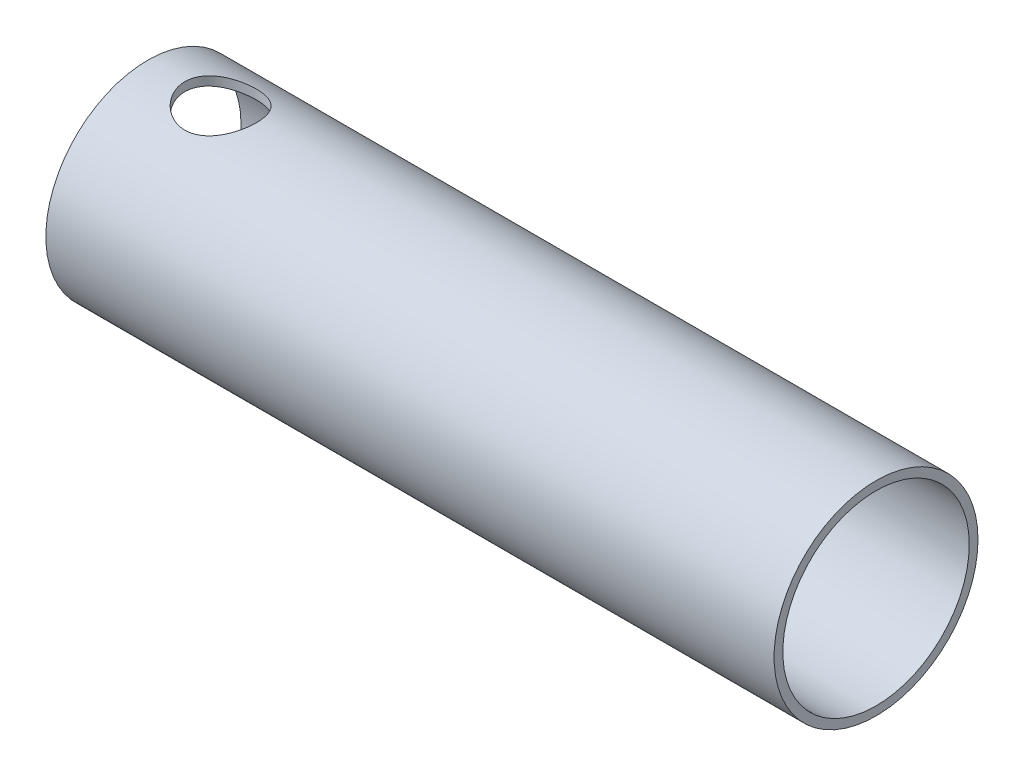
from build123d import *

# Parameters (mm, degrees)
SKETCH3_R               = 35
SKETCH3_R_2             = 32
BOSS_EXTRUDE1_DEPTH     = 250
CUT_EXTRUDE1_DEPTH      = 255.852898747
CUT_EXTRUDE1_DEPTH_BACK = 255.852898747
SKETCH4_R               = 12.25


with BuildPart() as part:
    # Sketch3 → Boss-Extrude1 (new body)
    with BuildSketch(Plane(origin=(0, 0, 0), x_dir=(0, 0, -1), z_dir=(1, 0, 0))):
        Circle(SKETCH3_R)
        Circle(SKETCH3_R_2, mode=Mode.SUBTRACT)
    extrude(amount=BOSS_EXTRUDE1_DEPTH)

    # Sketch4 → Cut-Extrude1 (cut, two sides: drawn at the far end of the back side and taken through both)
    with BuildSketch(Plane(origin=(0, 0, 0), x_dir=(1, 0, 0), z_dir=(0, 1, 0)).offset(-CUT_EXTRUDE1_DEPTH_BACK)):
        with Locations((25, 0)):
            Circle(SKETCH4_R)
    extrude(amount=CUT_EXTRUDE1_DEPTH + CUT_EXTRUDE1_DEPTH_BACK, mode=Mode.SUBTRACT)


solid = part.part
